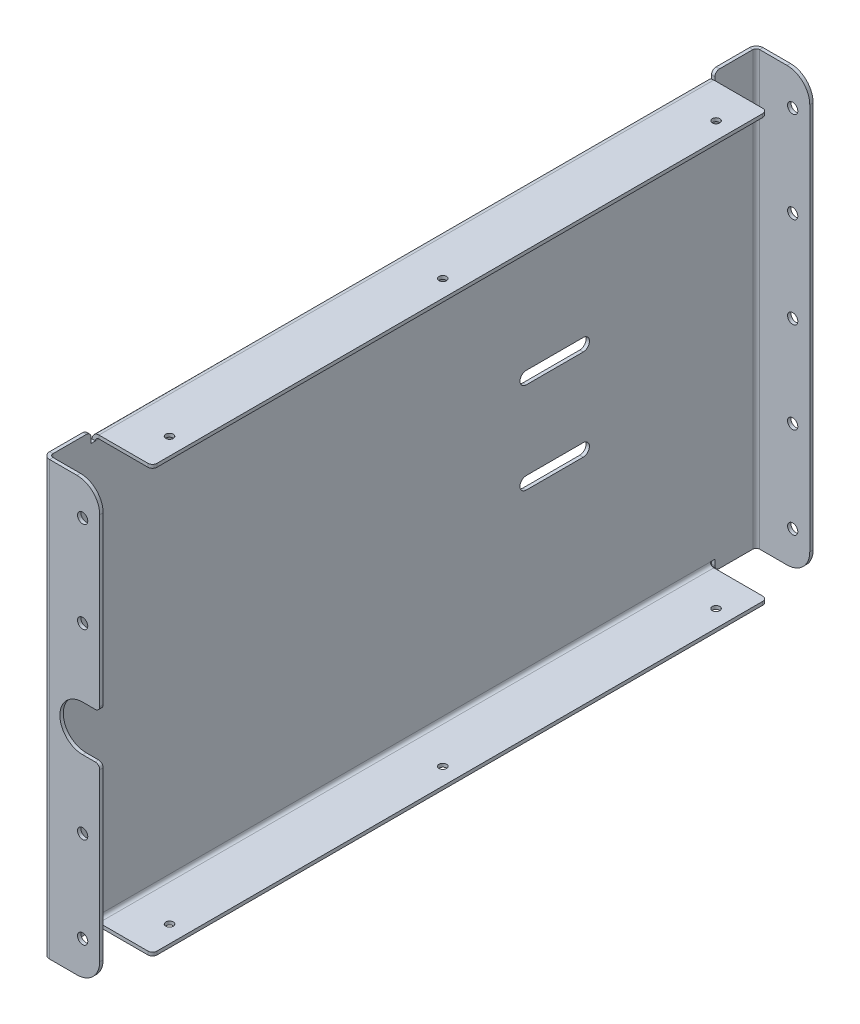
from build123d import *

# Parameters (mm, degrees)
BRIDA_BASE1_DEPTH           = 95
CROQUIS4_W                  = 274
CROQUIS4_H                  = 4.5
CORTAR_EXTRUIR1_DEPTH       = 10
BRIDA_DE_ARISTA1_DEPTH      = 270
BRIDA_DE_ARISTA1_BEND_DEPTH = 270
MATRIZL1_COUNT              = 3
MATRIZL1_PITCH              = 40
MATRIZL1_COL_COUNT          = 3
MATRIZL1_COL_PITCH          = 40
REDONDEO1_R                 = 10
TALADRO_ROSCADO_M41_D       = 3.3
MATRIZL2_COUNT              = 2
MATRIZL2_PITCH              = 120
MATRIZL2_COL_COUNT          = 2
MATRIZL2_COL_PITCH          = 120
CORTAR_EXTRUIR3_DEPTH       = 10
REDONDEO2_R                 = 2
CORTAR_EXTRUIR4_DEPTH       = 10


# Sheet-metal steps are written as plain solids
with BuildPart() as part:
    # Croquis1 → Brida base1 (new, symmetric)
    with BuildSketch(Plane(origin=(0, 0, 0), x_dir=(1, 0, 0), z_dir=(0, 1, 0))):
        with BuildLine():
            Line((25, -156.65), (3, -156.65))
            ThreePointArc((3, -156.65), (0.878679656, -155.771320344), (0, -153.65))
            Line((0, -153.65), (0, 153.65))
            ThreePointArc((0, 153.65), (0.878679656, 155.771320344), (3, 156.65))
            Line((3, 156.65), (25, 156.65))
            Line((25, 156.65), (25, 155.15))
            Line((25, 155.15), (3, 155.15))
            ThreePointArc((3, 155.15), (1.939339828, 154.710660172), (1.5, 153.65))
            Line((1.5, 153.65), (1.5, -153.65))
            ThreePointArc((1.5, -153.65), (1.939339828, -154.710660172), (3, -155.15))
            Line((3, -155.15), (25, -155.15))
            Line((25, -155.15), (25, -156.65))
        make_face()
    extrude(amount=BRIDA_BASE1_DEPTH, both=True)

    # Croquis4 → Cortar-Extruir1 (cut)
    with BuildSketch(Plane.ZY):
        with Locations((0, 92.75)):
            Rectangle(CROQUIS4_W, CROQUIS4_H)
    cortar_extruir1 = extrude(amount=-CORTAR_EXTRUIR1_DEPTH, mode=Mode.SUBTRACT)

    # Simetría3: Cortar-Extruir1 across plane
    add(cortar_extruir1.mirror(Plane.ZX), mode=Mode.SUBTRACT)

    # Brida de arista1 section (across the edge) → Brida de arista1 (add)
    with BuildSketch(Plane(origin=(1.5, 92, -135), x_dir=(0, -1, 0), z_dir=(0, 0, 1))):
        with BuildLine():
            Line((-1.5, 1.5), (-1.5, 25))
            Line((-1.5, 25), (0, 25))
            Line((0, 25), (0, 1.5))
            ThreePointArc((0, 1.5), (0.439339828, 0.439339828), (1.5, 0))
            Line((1.5, 0), (1.5, -1.5))
            ThreePointArc((1.5, -1.5), (-0.621320344, -0.621320344), (-1.5, 1.5))
        make_face()
    extrude(amount=BRIDA_DE_ARISTA1_DEPTH)

    # Brida de arista1 section 2 (across the edge) → Brida de arista1 bend (add)
    with BuildSketch(Plane(origin=(1.5, -92, 135), x_dir=(0, 1, 0), z_dir=(0, 0, -1))):
        with BuildLine():
            Line((-1.5, 1.5), (-1.5, 25))
            Line((-1.5, 25), (0, 25))
            Line((0, 25), (0, 1.5))
            ThreePointArc((0, 1.5), (0.439339828, 0.439339828), (1.5, 0))
            Line((1.5, 0), (1.5, -1.5))
            ThreePointArc((1.5, -1.5), (-0.621320344, -0.621320344), (-1.5, 1.5))
        make_face()
    extrude(amount=BRIDA_DE_ARISTA1_BEND_DEPTH)

    # Croquis11 → Taladro de margen para M41 (revolve, cut)
    with BuildSketch(Plane(origin=(17.5, 0, -156.65), x_dir=(0, 1, 0), z_dir=(1, 0, 0))):
        Polygon((0, 0), (0, 501.351936393), (2.25, 500), (2.25, 0), align=None)
    taladro_de_margen_para_m41 = revolve(axis=Axis((17.5, 0, -163), (0, 0, 1)), mode=Mode.SUBTRACT)

    # MatrizL1: Taladro de margen para M41 ×3
    with Locations(*[(0, -i * MATRIZL1_PITCH, 0) for i in range(1, MATRIZL1_COUNT)]):
        add(taladro_de_margen_para_m41, mode=Mode.SUBTRACT)

    # MatrizL1 col: Taladro de margen para M41 ×3
    with Locations(*[(0, i * MATRIZL1_COL_PITCH, 0) for i in range(1, MATRIZL1_COL_COUNT)]):
        add(taladro_de_margen_para_m41, mode=Mode.SUBTRACT)

    # Redondeo1
    redondeo1_edges = [part.edges().sort_by_distance(p)[0] for p in [
        (25, -95, 155.9),
        (25, -95, -155.9),
        (25, 95, 155.9),
        (25, 95, -155.9),
    ]]
    fillet(redondeo1_edges, radius=REDONDEO1_R)

    # Taladro roscado M41 (through all)
    with Locations(Plane(origin=(0, 93.5, 0), x_dir=(1, 0, 0), z_dir=(0, 1, 0))):
        with Locations((19, 0)):
            taladro_roscado_m41 = Hole(TALADRO_ROSCADO_M41_D / 2)

    # MatrizL2: Taladro roscado M41 ×2
    with Locations(*[(0, 0, i * MATRIZL2_PITCH) for i in range(1, MATRIZL2_COUNT)]):
        add(taladro_roscado_m41, mode=Mode.SUBTRACT)

    # MatrizL2 col: Taladro roscado M41 ×2
    with Locations(*[(0, 0, -i * MATRIZL2_COL_PITCH) for i in range(1, MATRIZL2_COL_COUNT)]):
        add(taladro_roscado_m41, mode=Mode.SUBTRACT)

    # Croquis20 → Cortar-Extruir3 (cut)
    with BuildSketch(Plane(origin=(0, 0, 155.15), x_dir=(-1, 0, 0), z_dir=(0, 0, -1))):
        with BuildLine():
            Line((-17.5, -10), (-25, -10))
            ThreePointArc((-25, -10), (-35, 0), (-25, 10))
            Line((-25, 10), (-17.5, 10))
            ThreePointArc((-17.5, 10), (-7.5, 0), (-17.5, -10))
        make_face()
    extrude(amount=-CORTAR_EXTRUIR3_DEPTH, mode=Mode.SUBTRACT)

    # Redondeo2
    redondeo2_edges = [part.edges().sort_by_distance(p)[0] for p in [
        (26.5, -92.75, 135),
        (26.5, -92.75, -135),
        (25, -10, 155.9),
        (25, 10, 155.9),
        (0.75, 95, -137),
        (0.75, 95, 137),
        (0.75, -95, -137),
        (0.75, -95, 137),
        (26.5, 92.75, -135),
        (26.5, 92.75, 135),
    ]]
    fillet(redondeo2_edges, radius=REDONDEO2_R)

    # Croquis21 → Cortar-Extruir4 (cut)
    with BuildSketch(Plane.ZY):
        with BuildLine():
            Line((-79.15, -17.25), (-54.15, -17.25))
            ThreePointArc((-54.15, -17.25), (-51.4, -20), (-54.15, -22.75))
            Line((-54.15, -22.75), (-79.15, -22.75))
            ThreePointArc((-79.15, -22.75), (-81.9, -20), (-79.15, -17.25))
        make_face()
        with BuildLine():
            Line((-79.15, 22.75), (-54.15, 22.75))
            ThreePointArc((-54.15, 22.75), (-51.4, 20), (-54.15, 17.25))
            Line((-54.15, 17.25), (-79.15, 17.25))
            ThreePointArc((-79.15, 17.25), (-81.9, 20), (-79.15, 22.75))
        make_face()
    extrude(amount=-CORTAR_EXTRUIR4_DEPTH, mode=Mode.SUBTRACT)


solid = part.part
